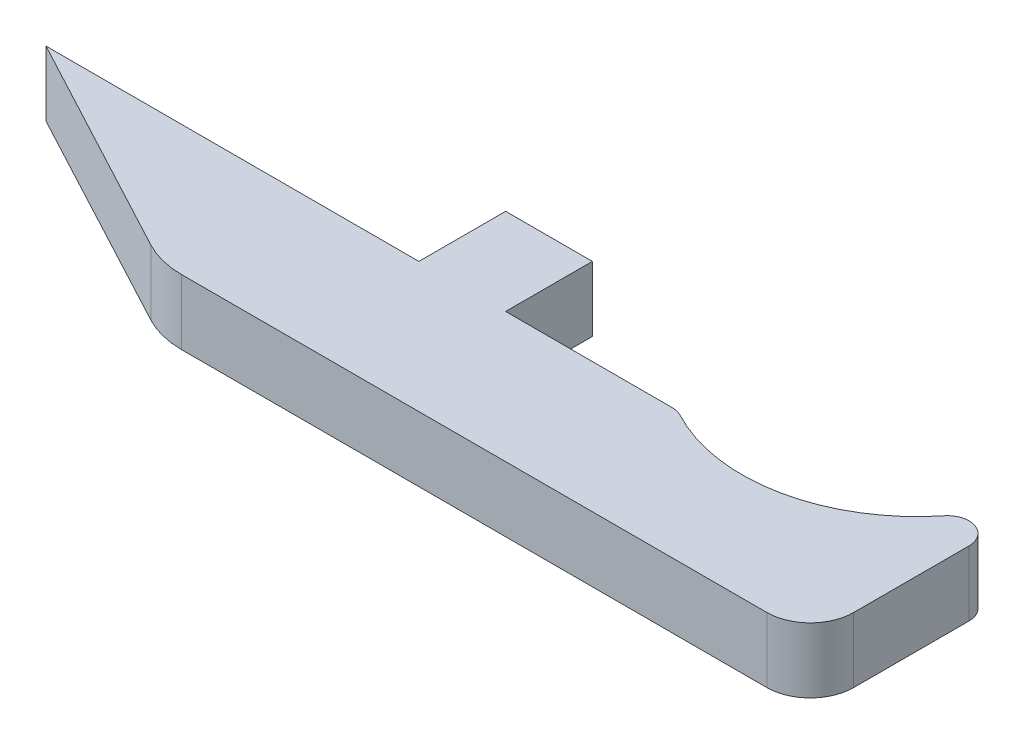
from build123d import *

# Parameters (mm, degrees)
BOSS_EXTRUDE1_DEPTH = 4.7625
FILLET1_R           = 1.5875
FILLET2_R           = 6.35
FILLET3_R           = 3.175
SKETCH2_W           = 6.35
SKETCH2_H           = 4.7625
BOSS_EXTRUDE2_DEPTH = 6.35


with BuildPart() as part:
    # Sketch1 → Boss-Extrude1 (new body)
    with BuildSketch(Plane(origin=(0, 0, 0), x_dir=(1, 0, 0), z_dir=(0, 1, 0))):
        with BuildLine():
            ThreePointArc((71.770239996, -34.146630992), (65.371223106, -45.24676442), (52.558738922, -45.271830992))
            Line((52.558738922, -45.271830992), (6.2845, -45.271830992))
            Line((6.2845, -45.271830992), (24.145239996, -54.796830992))
            Line((24.145239996, -54.796830992), (71.770239996, -54.796830992))
            Line((71.770239996, -54.796830992), (71.770239996, -34.146630992))
        make_face()
    extrude(amount=BOSS_EXTRUDE1_DEPTH)

    # Fillet1
    fillet1_edges = [part.edges().sort_by_distance(p)[0] for p in [
        (52.558738922, 2.38125, 45.271830992),
        (71.770239996, 2.38125, 34.146630992),
    ]]
    fillet(fillet1_edges, radius=FILLET1_R)

    # Fillet2
    fillet2_edges = [part.edges().sort_by_distance(p)[0] for p in [
        (24.145239996, 2.38125, 54.796830992),
    ]]
    fillet(fillet2_edges, radius=FILLET2_R)

    # Fillet3
    fillet3_edges = [part.edges().sort_by_distance(p)[0] for p in [
        (71.770239996, 2.38125, 54.796830992),
    ]]
    fillet(fillet3_edges, radius=FILLET3_R)

    # Sketch2 → Boss-Extrude2 (add)
    with BuildSketch(Plane(origin=(0, 0, 45.271830992), x_dir=(-1, 0, 0), z_dir=(0, 0, -1))):
        with Locations((-36.7645, 2.38125)):
            Rectangle(SKETCH2_W, SKETCH2_H)
    extrude(amount=BOSS_EXTRUDE2_DEPTH)


solid = part.part
